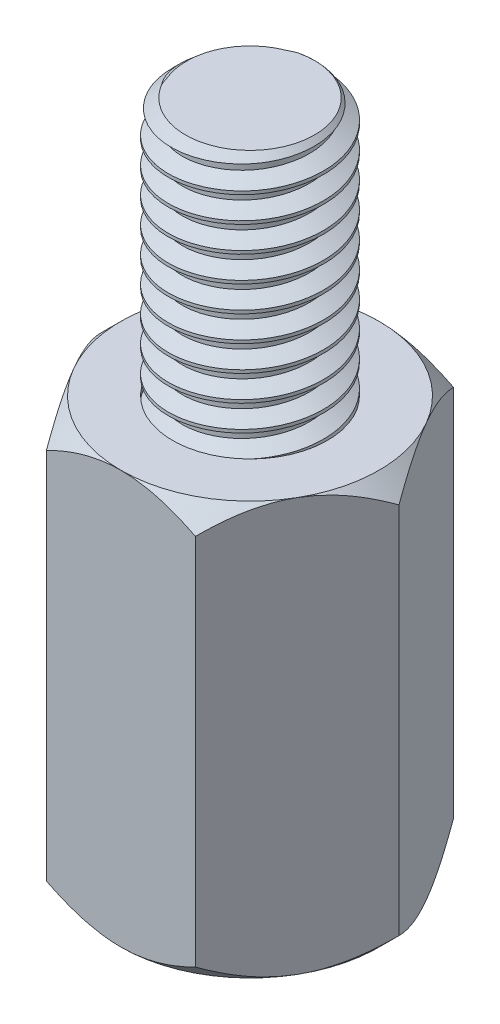
from build123d import *

# Parameters (mm, degrees)
ADJUSTABLE_HEIGHT_DEPTH      = 4
ADJUSTABLE_HEIGHT_DEPTH_BACK = 4
TROU_TARAUD_M31_D            = 2.5
TROU_TARAUD_M31_DEPTH        = 20
TROU_TARAUD_M31_CSINK_D      = 3.5
TROU_TARAUD_M31_CSINK_ANGLE  = 90
TROU_TARAUD_M31_TIP          = 0.751075774
ESQUISSE6_R                  = 1.5
BOSS_EXTRU_1_DEPTH           = 5
CHANFREIN1_SIZE              = 0.25
FILETAGE3_PITCH              = 0.5


with BuildPart() as part:
    # Esquisse1 → Adjustable height (new, two sides: drawn at the far end of the back side and taken through both)
    with BuildSketch(Plane(origin=(0, 0, 0), x_dir=(1, 0, 0), z_dir=(0, 1, 0)).offset(-ADJUSTABLE_HEIGHT_DEPTH_BACK)):
        Polygon((-2.886751346, 0), (-1.443375673, -2.5), (1.443375673, -2.5), (2.886751346, 0), (1.443375673, 2.5), (-1.443375673, 2.5), align=None)
    extrude(amount=ADJUSTABLE_HEIGHT_DEPTH + ADJUSTABLE_HEIGHT_DEPTH_BACK)

    # Trou taraudé M31
    with Locations(Plane(origin=(0, -4, 0), x_dir=(-1, 0, 0), z_dir=(0, -1, 0))):
        with Locations((0, 0)):
            CounterSinkHole(TROU_TARAUD_M31_D / 2, TROU_TARAUD_M31_CSINK_D / 2, depth=TROU_TARAUD_M31_DEPTH, counter_sink_angle=TROU_TARAUD_M31_CSINK_ANGLE)
            with Locations((0, 0, -(TROU_TARAUD_M31_DEPTH + TROU_TARAUD_M31_TIP / 2))):  # 118° drill point
                Cone(0, TROU_TARAUD_M31_D / 2, TROU_TARAUD_M31_TIP, mode=Mode.SUBTRACT)

    # Esquisse5 → Enlèvement de matière-Révolution1 (revolve, cut)
    with BuildSketch(Plane(origin=(0, 0, 0), x_dir=(0, 0, -1), z_dir=(1, 0, 0)), mode=Mode.PRIVATE) as enl_vement_de_mati_re_r_volution1_sk:
        Polygon((-2.5, 4), (-3.5, 3), (-3.5, 4), align=None)
        Polygon((-3.5, -3), (-3.5, -4), (-2.5, -4), align=None)
    revolve(enl_vement_de_mati_re_r_volution1_sk.sketch.rotate(Axis((0, 23.826611975, 0), (0, -1, 0)), 180), axis=Axis((0, 23.826611975, 0), (0, -1, 0)), mode=Mode.SUBTRACT)

    # Esquisse6 → Boss.-Extru.1 (add)
    with BuildSketch(Plane(origin=(0, 4, 0), x_dir=(1, 0, 0), z_dir=(0, 1, 0))):
        with Locations(Location((0, 0, 0), (0, 0, 270))):
            Circle(ESQUISSE6_R)
    extrude(amount=BOSS_EXTRU_1_DEPTH)

    # Chanfrein1
    chanfrein1_edges = [part.edges().sort_by_distance(p)[0] for p in [
        (0, 9, -1.5),
    ]]
    chamfer(chanfrein1_edges, length=CHANFREIN1_SIZE)

    # Filetage3: the profile of Profil de filetage6 profile screwed along a right-hand helix of 11 turns, 6 arcs to a turn; built about Z, then put on its axis
    filetage3_z = Axis((0, 0, 0), (0, 0, 1))
    filetage3_corners = [(1.5003, 0, -0.000173205), (1.5003, 0, 0.437673204), (1.229367063, 0, 0.281249999), (1.229367063, 0, 0.156249999)]
    with BuildLine(mode=Mode.PRIVATE) as filetage3_profile:
        Line(filetage3_corners[0], filetage3_corners[1])
        Line(filetage3_corners[1], filetage3_corners[2])
        Line(filetage3_corners[2], filetage3_corners[3])
        Line(filetage3_corners[3], filetage3_corners[0])
    filetage3_cap = Face(filetage3_profile.wire())
    filetage3_turn_angles = [0, 30, 60, 90, 120, 150, 180, 210, 240, 270, 300, 330, 360]
    filetage3_turn_weights = [1, 0.8660254037844387, 1, 0.8660254037844387, 1, 0.8660254037844387, 1, 0.8660254037844387, 1, 0.8660254037844387, 1, 0.8660254037844387, 1]
    filetage3_turn_rails = [Edge.make_bspline([Vector(p[0], p[1], 0).rotate(filetage3_z, filetage3_turn_angles[k]) / filetage3_turn_weights[k] + Vector(0, 0, p[2] + FILETAGE3_PITCH * filetage3_turn_angles[k] / 360) for k in range(13)], [0, 0, 0, 1, 1, 2, 2, 3, 3, 4, 4, 5, 5, 6, 6, 6], 2, filetage3_turn_weights) for p in filetage3_corners]
    filetage3_turn_sides = [Face.make_surface_from_curves(filetage3_turn_rails[p[0]], filetage3_turn_rails[p[1]]) for p in [(0, 1), (1, 2), (2, 3), (3, 0)]]
    filetage3 = Plane(origin=(0, 9.75, 0), x_dir=(-1, 0, 0), z_dir=(0, -1, 0)) * Solid(Shell([*[p.moved(Location((0, 0, FILETAGE3_PITCH * i))) for i in range(11) for p in filetage3_turn_sides], filetage3_cap, filetage3_cap.rotate(filetage3_z, 3960).moved(Location((0, 0, FILETAGE3_PITCH * 3960 / 360)))]))
    add(filetage3, mode=Mode.SUBTRACT)


solid = part.part
